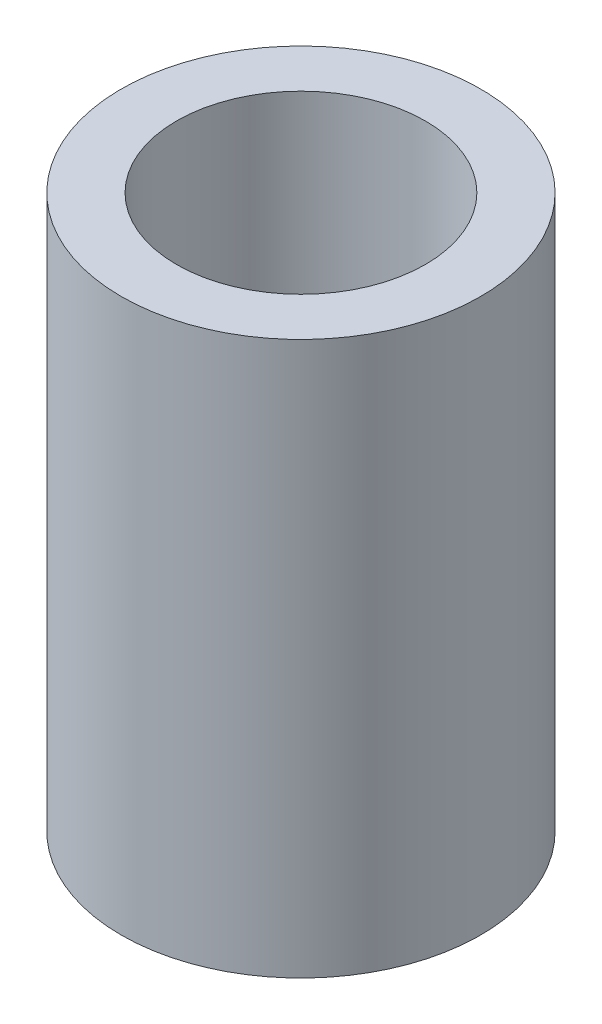
from build123d import *

# Parameters (mm, degrees)
SKETCH1_R           = 4.127000001
SKETCH1_R_2         = 2.857000001
BOSS_EXTRUDE1_DEPTH = 12.7


with BuildPart() as part:
    # Sketch1 → Boss-Extrude1 (new body)
    with BuildSketch(Plane(origin=(0, 0, 0), x_dir=(1, 0, 0), z_dir=(0, 1, 0))):
        Circle(SKETCH1_R)
        Circle(SKETCH1_R_2, mode=Mode.SUBTRACT)
    extrude(amount=BOSS_EXTRUDE1_DEPTH)


solid = part.part
